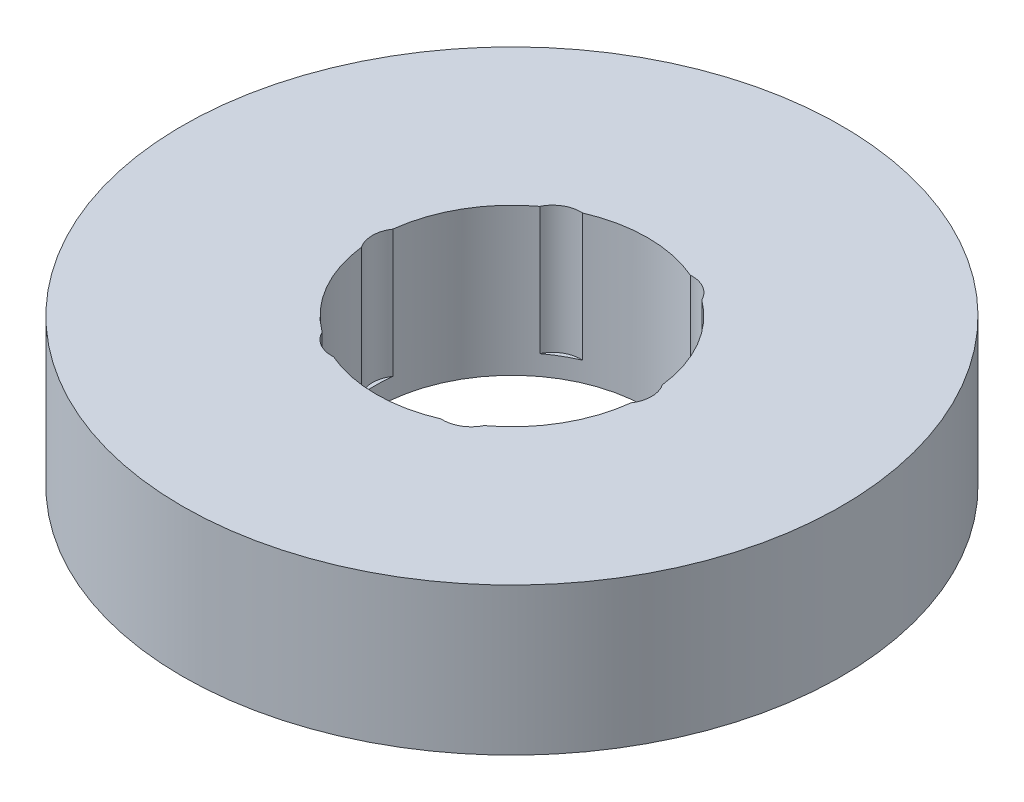
from build123d import *

# Parameters (mm, degrees)
SKETCH1_R           = 42.5
BOSS_EXTRUDE1_DEPTH = 19
SKETCH2_R           = 17.5
CUT_EXTRUDE1_DEPTH  = 64.035704168
SKETCH3_R           = 3.633374968
CUT_EXTRUDE2_DEPTH  = 16.446134519
CIRPATTERN1_COUNT   = 6


with BuildPart() as part:
    # Sketch1 → Boss-Extrude1 (new body)
    with BuildSketch(Plane(origin=(0, 0, 0), x_dir=(1, 0, 0), z_dir=(0, 1, 0))):
        Circle(SKETCH1_R)
    extrude(amount=BOSS_EXTRUDE1_DEPTH)

    # Sketch2 → Cut-Extrude1 (cut, through all)
    with BuildSketch(Plane(origin=(0, 0, 0), x_dir=(1, 0, 0), z_dir=(0, 1, 0))):
        Circle(SKETCH2_R)
    extrude(amount=CUT_EXTRUDE1_DEPTH, mode=Mode.SUBTRACT)

    # Sketch3 → Cut-Extrude2 (cut)
    with BuildSketch(Plane(origin=(0, 19, 0), x_dir=(1, 0, 0), z_dir=(0, 1, 0))):
        with Locations((-14.363027448, 0)):
            Circle(SKETCH3_R)
    cut_extrude2 = extrude(amount=-CUT_EXTRUDE2_DEPTH, mode=Mode.SUBTRACT)

    # CirPattern1: Cut-Extrude2 ×6 about axis
    cirpattern1_axis = Axis((0, 0, 0), (0, 1, 0))
    for i in range(1, CIRPATTERN1_COUNT):
        add(cut_extrude2.rotate(cirpattern1_axis, i * 360 / CIRPATTERN1_COUNT), mode=Mode.SUBTRACT)


solid = part.part
